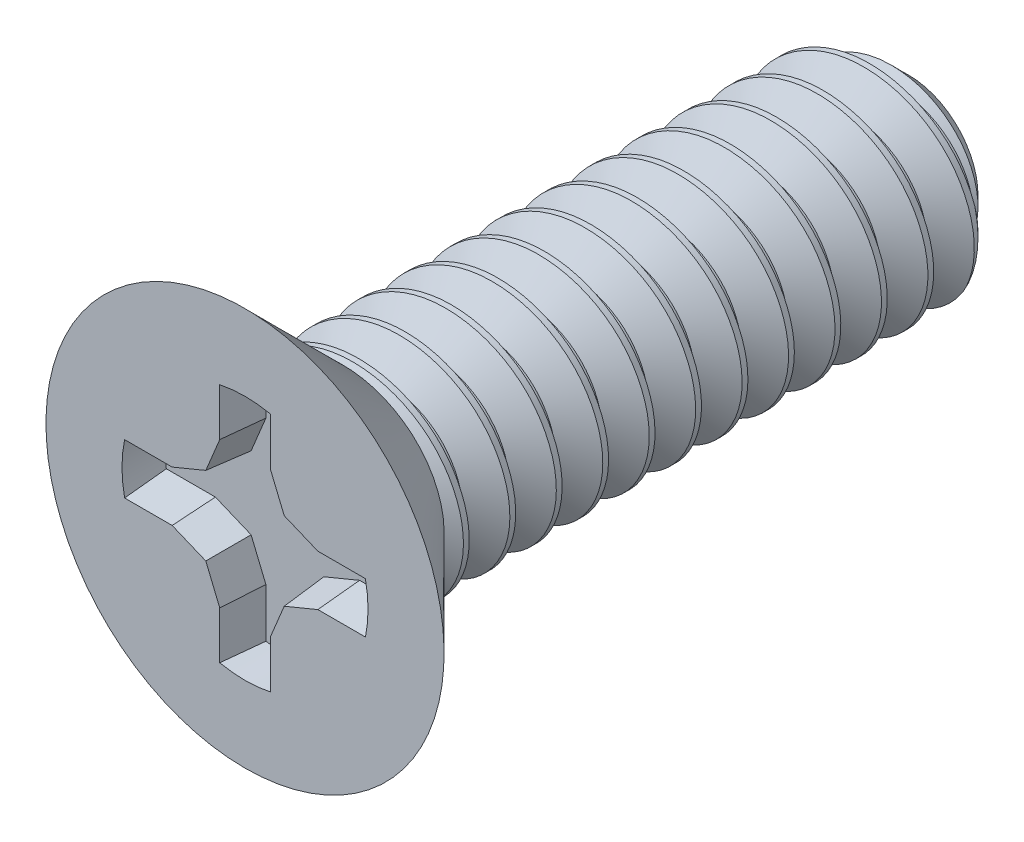
from build123d import *

# Parameters (mm, degrees)
CUT_EXTRUDE1_DEPTH  = 0.32
CIRPATTERN1_COUNT   = 4
DRAFT2_ANGLE        = 5
CUT_SWEEP1_PITCH    = 0.35
SKETCH8_R           = 0.8
BOSS_EXTRUDE1_DEPTH = 0.26
BOSS_EXTRUDE1_DRAFT = -45


with BuildPart() as part:
    # Sketch3 → Revolve1 (revolve)
    with BuildSketch(Plane(origin=(0, 0, 0), x_dir=(0, 0, -1), z_dir=(1, 0, 0)), mode=Mode.PRIVATE) as revolve1_sk:
        Polygon((-0.96, 0), (-0.96, 1.5), (-0.26, 0.8), (-0.26, 0), align=None)
    revolve(revolve1_sk.sketch.rotate(Axis((0, 0, 0.96), (0, 0, -1)), 180), axis=Axis((0, 0, 0.96), (0, 0, -1)))

    # Sketch5 → Revolve2 (revolve)
    with BuildSketch(Plane(origin=(0, 0, 0), x_dir=(0, 0, -1), z_dir=(1, 0, 0))):
        Polygon((4.04, 0), (-0.26, 0), (-0.26, 0.8), (3.7635, 0.8), (4.04, 0.5235), align=None)
    revolve(axis=Axis((0, 0, -4.04), (0, 0, 1)))

    # Sketch4 → Cut-Extrude1 (cut)
    with BuildSketch(Plane.XY.offset(0.96)):
        with BuildLine():
            Line((0, 0), (0.9271, 0))
            ThreePointArc((0.9271, 0), (0.92214099, 0.095762227), (0.907317012, 0.1905))
            Line((0.907317012, 0.1905), (0.548908506, 0.1905))
            Line((0.548908506, 0.1905), (0.295475421, 0.295475421))
            Line((0.295475421, 0.295475421), (0.1905, 0.548908506))
            Line((0.1905, 0.548908506), (0.1905, 0.907317012))
            ThreePointArc((0.1905, 0.907317012), (0.095762227, 0.92214099), (0, 0.9271))
            Line((0, 0.9271), (0, 0))
        make_face()
    cut_extrude1 = extrude(amount=-CUT_EXTRUDE1_DEPTH, mode=Mode.SUBTRACT)

    # CirPattern1: Cut-Extrude1 ×4 about axis
    cirpattern1_axis = Axis((0, 0, 0), (0, 0, 1))
    for i in range(1, CIRPATTERN1_COUNT):
        add(cut_extrude1.rotate(cirpattern1_axis, i * 360 / CIRPATTERN1_COUNT), mode=Mode.SUBTRACT)

    # Draft2
    draft2_faces = [part.faces().sort_by_distance(p)[0] for p in [
        (-0.728112759, 0.1905, 0.8),
        (-0.422191963, 0.24298771, 0.8),
        (-0.24298771, 0.422191963, 0.8),
        (-0.1905, 0.728112759, 0.8),
        (0.1905, 0.728112759, 0.8),
        (0.24298771, 0.422191963, 0.8),
        (0.422191963, 0.24298771, 0.8),
        (0.728112759, 0.1905, 0.8),
        (0.728112759, -0.1905, 0.8),
        (0.422191963, -0.24298771, 0.8),
        (0.24298771, -0.422191963, 0.8),
        (0.1905, -0.728112759, 0.8),
        (-0.1905, -0.728112759, 0.8),
        (-0.24298771, -0.422191963, 0.8),
        (-0.422191963, -0.24298771, 0.8),
        (-0.728112759, -0.1905, 0.8),
    ]]
    draft(draft2_faces, Plane(origin=(0, 0, 0.96), x_dir=(0, 1, 0), z_dir=(0, 0, 1)), DRAFT2_ANGLE)


with BuildPart() as body_2:
    # Split1: the piece on the far side of the plane
    add(part.part)
    split(bisect_by=Plane(origin=(0, 0, 0.26), x_dir=(0, -1, 0), z_dir=(0, 0, -1)), keep=Keep.BOTTOM)


with BuildPart() as part_1:
    add(part.part)

    # Split1
    split(bisect_by=Plane(origin=(0, 0, 0.26), x_dir=(0, -1, 0), z_dir=(0, 0, -1)), keep=Keep.TOP)

    # Cut-Sweep1: the profile of Sketch7 screwed along a right-hand helix of 14.285714 turns, 6 arcs to a turn; built about Z, then put on its axis
    cut_sweep1_z = Axis((0, 0, 0), (0, 0, 1))
    cut_sweep1_corners = [(0.572668332, 0, -0.175), (0.572668332, 0, -0.13125), (0.818944306, 0, 0.0109375), (0.818944306, 0, -0.3171875)]
    with BuildLine(mode=Mode.PRIVATE) as cut_sweep1_profile:
        Line(cut_sweep1_corners[0], cut_sweep1_corners[1])
        Line(cut_sweep1_corners[1], cut_sweep1_corners[2])
        Line(cut_sweep1_corners[2], cut_sweep1_corners[3])
        Line(cut_sweep1_corners[3], cut_sweep1_corners[0])
    cut_sweep1_cap = Face(cut_sweep1_profile.wire())
    cut_sweep1_turn_angles = [0, 30, 60, 90, 120, 150, 180, 210, 240, 270, 300, 330, 360]
    cut_sweep1_turn_weights = [1, 0.8660254037844387, 1, 0.8660254037844387, 1, 0.8660254037844387, 1, 0.8660254037844387, 1, 0.8660254037844387, 1, 0.8660254037844387, 1]
    cut_sweep1_turn_rails = [Edge.make_bspline([Vector(p[0], p[1], 0).rotate(cut_sweep1_z, cut_sweep1_turn_angles[k]) / cut_sweep1_turn_weights[k] + Vector(0, 0, p[2] + CUT_SWEEP1_PITCH * cut_sweep1_turn_angles[k] / 360) for k in range(13)], [0, 0, 0, 1, 1, 2, 2, 3, 3, 4, 4, 5, 5, 6, 6, 6], 2, cut_sweep1_turn_weights) for p in cut_sweep1_corners]
    cut_sweep1_turn_sides = [Face.make_surface_from_curves(cut_sweep1_turn_rails[p[0]], cut_sweep1_turn_rails[p[1]]) for p in [(0, 1), (1, 2), (2, 3), (3, 0)]]
    cut_sweep1_last_angles = [5040, 5070, 5100, 5121.428571429, 5142.857142857]
    cut_sweep1_last_weights = [1, 0.8660254037844387, 1, 0.930873748644131, 1]
    cut_sweep1_last_rails = [Edge.make_bspline([Vector(p[0], p[1], 0).rotate(cut_sweep1_z, cut_sweep1_last_angles[k]) / cut_sweep1_last_weights[k] + Vector(0, 0, p[2] + CUT_SWEEP1_PITCH * cut_sweep1_last_angles[k] / 360) for k in range(5)], [0, 0, 0, 1, 1, 2, 2, 2], 2, cut_sweep1_last_weights) for p in cut_sweep1_corners]
    cut_sweep1_last_sides = [Face.make_surface_from_curves(cut_sweep1_last_rails[p[0]], cut_sweep1_last_rails[p[1]]) for p in [(0, 1), (1, 2), (2, 3), (3, 0)]]
    cut_sweep1 = Plane(origin=(0, 0, -4.04), x_dir=(0, 1, 0), z_dir=(0, 0, 1)) * Solid(Shell([*[p.moved(Location((0, 0, CUT_SWEEP1_PITCH * i))) for i in range(14) for p in cut_sweep1_turn_sides], *cut_sweep1_last_sides, cut_sweep1_cap, cut_sweep1_cap.rotate(cut_sweep1_z, 5142.857142857).moved(Location((0, 0, CUT_SWEEP1_PITCH * 5142.857142857 / 360)))]))
    add(cut_sweep1, mode=Mode.SUBTRACT)


with BuildPart() as body_2_1:
    add(body_2.part)

    # Combine1: union part
    add(part_1.part)


with BuildPart() as boss_extrude1_tool:
    # Sketch8 → Boss-Extrude1 (with draft: the straight prism first)
    with BuildSketch(Plane.XY.offset(0.26)):
        Circle(SKETCH8_R)
    extrude(amount=-BOSS_EXTRUDE1_DEPTH)
    # Boss-Extrude1: the draft: its side faces are tilted about the plane it starts from
    boss_extrude1_sides = [boss_extrude1_tool.faces().sort_by_distance(p)[0] for p in [
        (-0.8, 0, 0.13),
    ]]
    draft(boss_extrude1_sides, Plane.XY.offset(0.26), BOSS_EXTRUDE1_DRAFT)


with BuildPart() as body_2_2:
    add(body_2_1.part)

    # Boss-Extrude1: add boss_extrude1_tool
    add(boss_extrude1_tool.part)


solid = body_2_2.part
